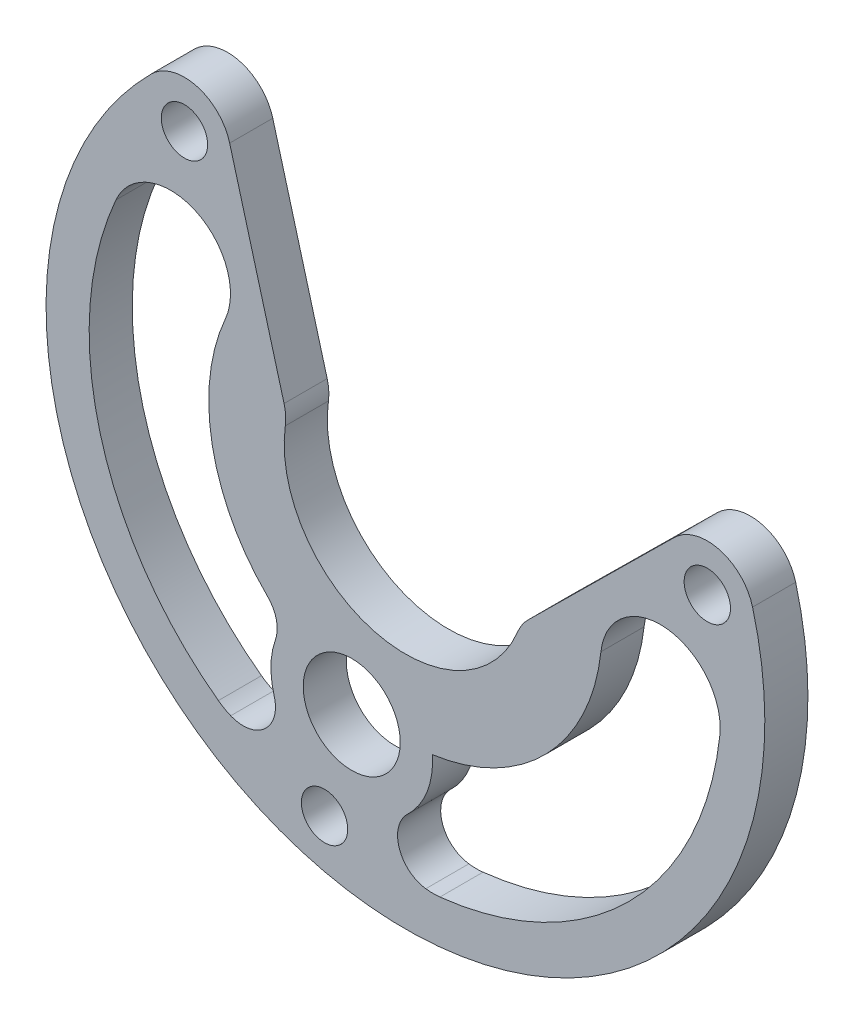
from build123d import *

# Parameters (mm, degrees)
SKETCH1_R           = 2.15
BOSS_EXTRUDE1_DEPTH = 4
SKETCH2_R           = 4.500000001
CUT_EXTRUDE1_DEPTH  = 10
BOSS_EXTRUDE2_START = -4
SKETCH3_R           = 7.499999999
SKETCH3_R_2         = 4.499999999
BOSS_EXTRUDE2_DEPTH = 4
FILLET1_R           = 3


with BuildPart() as part:
    # Sketch1 → Boss-Extrude1 (new body)
    with BuildSketch(Plane.XY):
        with BuildLine():
            Line((169.071208826, 34.599951739), (155.49789847, 21.187541922))
            ThreePointArc((155.49789847, 21.187541922), (154.94043739, 20.512931345), (154.52928773, 19.740391219))
            ThreePointArc((154.52928773, 19.740391219), (141.205165824, 13.133334454), (132.969666153, 25.51727441))
            ThreePointArc((132.969666153, 25.51727441), (132.999870165, 26.391888614), (132.854399997, 27.254849052))
            Line((132.854399997, 27.254849052), (127.805773323, 45.656991858))
            ThreePointArc((127.805773323, 45.656991858), (124.72411503, 48.711211723), (120.534868929, 47.582011153))
            ThreePointArc((120.534868929, 47.582011153), (135.485264927, -8.213626307), (176.330506388, 32.631615154))
            ThreePointArc((176.330506388, 32.631615154), (173.267113127, 35.704154585), (169.071208826, 34.599951739))
        make_face()
        with Locations((123.610783427, 44.506096654)):
            Circle(SKETCH1_R, mode=Mode.SUBTRACT)
        with Locations((172.128729044, 31.505752308)):
            Circle(SKETCH1_R, mode=Mode.SUBTRACT)
        with Locations((136.611127773, -4.011848962)):
            Circle(SKETCH1_R, mode=Mode.SUBTRACT)
        with BuildLine():
            ThreePointArc((127.410923425, 31.346666741), (124.564673615, 38.661300157), (117.250040198, 35.815050347))
            ThreePointArc((117.250040198, 35.815050347), (115.76695708, 16.403661026), (126.757039397, 0.334446311))
            ThreePointArc((126.757039397, 0.334446311), (134.51482266, 1.526838378), (133.322430592, 9.284621641))
            ThreePointArc((133.322430592, 9.284621641), (126.488733751, 19.276552427), (127.410923425, 31.346666741))
        make_face(mode=Mode.SUBTRACT)
        with BuildLine():
            ThreePointArc((173.291771113, 20.798713806), (168.38023766, 26.920955155), (162.25799631, 22.009421702))
            ThreePointArc((162.25799631, 22.009421702), (157.021578838, 11.095301243), (146.107458379, 5.858883771))
            ThreePointArc((146.107458379, 5.858883771), (141.195924926, -0.263357578), (147.318166275, -5.174891032))
            ThreePointArc((147.318166275, -5.174891032), (164.870464109, 3.246415972), (173.291771113, 20.798713806))
        make_face(mode=Mode.SUBTRACT)
    extrude(amount=BOSS_EXTRUDE1_DEPTH)

    # Sketch2 → Cut-Extrude1 (cut)
    with BuildSketch(Plane(origin=(0, 0, 0), x_dir=(-1, 0, 0), z_dir=(0, 0, -1))):
        with Locations((-139.134613463, 5.405927844)):
            Circle(SKETCH2_R)
    extrude(amount=-CUT_EXTRUDE1_DEPTH, mode=Mode.SUBTRACT)

    # Sketch3 → Boss-Extrude2 (add)
    with BuildSketch(Plane.XY.offset(4).offset(BOSS_EXTRUDE2_START)):
        with Locations((139.134613463, 5.405927844)):
            Circle(SKETCH3_R)
        with Locations((139.134613463, 5.405927844)):
            Circle(SKETCH3_R_2, mode=Mode.SUBTRACT)
    extrude(amount=BOSS_EXTRUDE2_DEPTH)

    # Fillet1
    fillet1_edges = [part.edges().sort_by_distance(p)[0] for p in [
        (133.492654971, 0.464439772, 2),
        (132.912874844, 9.594002407, 2),
        (141.549948809, -1.694505605, 2),
    ]]
    fillet(fillet1_edges, radius=FILLET1_R)


solid = part.part
